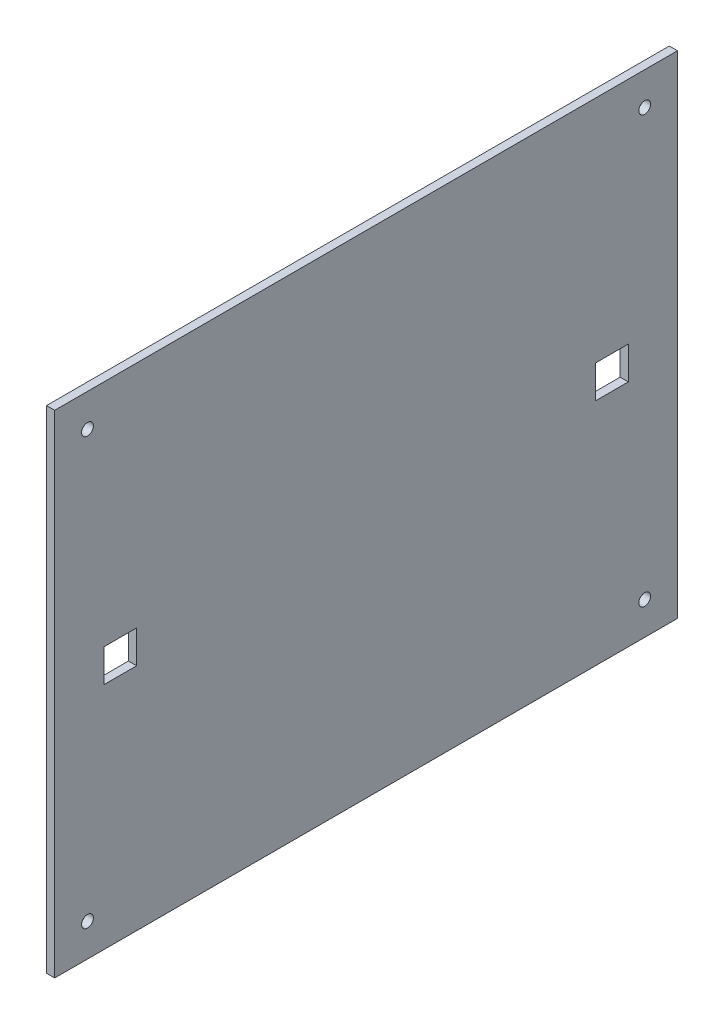
from build123d import *

# Parameters (mm, degrees)
SKETCH1_W           = 241.3
SKETCH1_H           = 190.5
BOSS_EXTRUDE1_DEPTH = 3.175
SKETCH2_R           = 2.286
CUT_EXTRUDE1_DEPTH  = 308.450842616
SKETCH3_W           = 12.7
SKETCH3_H           = 12.7
CUT_EXTRUDE2_DEPTH  = 308.450842616


with BuildPart() as part:
    # Sketch1 → Boss-Extrude1 (new body)
    with BuildSketch(Plane(origin=(0, 0, 0), x_dir=(0, 0, -1), z_dir=(1, 0, 0))):
        with Locations((120.65, 95.25)):
            Rectangle(SKETCH1_W, SKETCH1_H)
    extrude(amount=BOSS_EXTRUDE1_DEPTH)

    # Sketch2 → Cut-Extrude1 (cut, through all)
    with BuildSketch(Plane(origin=(3.175, 0, 0), x_dir=(0, 0, -1), z_dir=(1, 0, 0))):
        with Locations((228.6, 12.7)):
            Circle(SKETCH2_R)
        with Locations((228.6, 177.8)):
            Circle(SKETCH2_R)
        with Locations((12.7, 12.7)):
            Circle(SKETCH2_R)
        with Locations((12.7, 177.8)):
            Circle(SKETCH2_R)
    extrude(amount=-CUT_EXTRUDE1_DEPTH, mode=Mode.SUBTRACT)

    # Sketch3 → Cut-Extrude2 (cut, through all)
    with BuildSketch(Plane(origin=(3.175, 0, 0), x_dir=(0, 0, -1), z_dir=(1, 0, 0))):
        with Locations((25.4, 95.25)):
            Rectangle(SKETCH3_W, SKETCH3_H)
        with Locations((215.9, 95.25)):
            Rectangle(SKETCH3_W, SKETCH3_H)
    extrude(amount=-CUT_EXTRUDE2_DEPTH, mode=Mode.SUBTRACT)


solid = part.part
